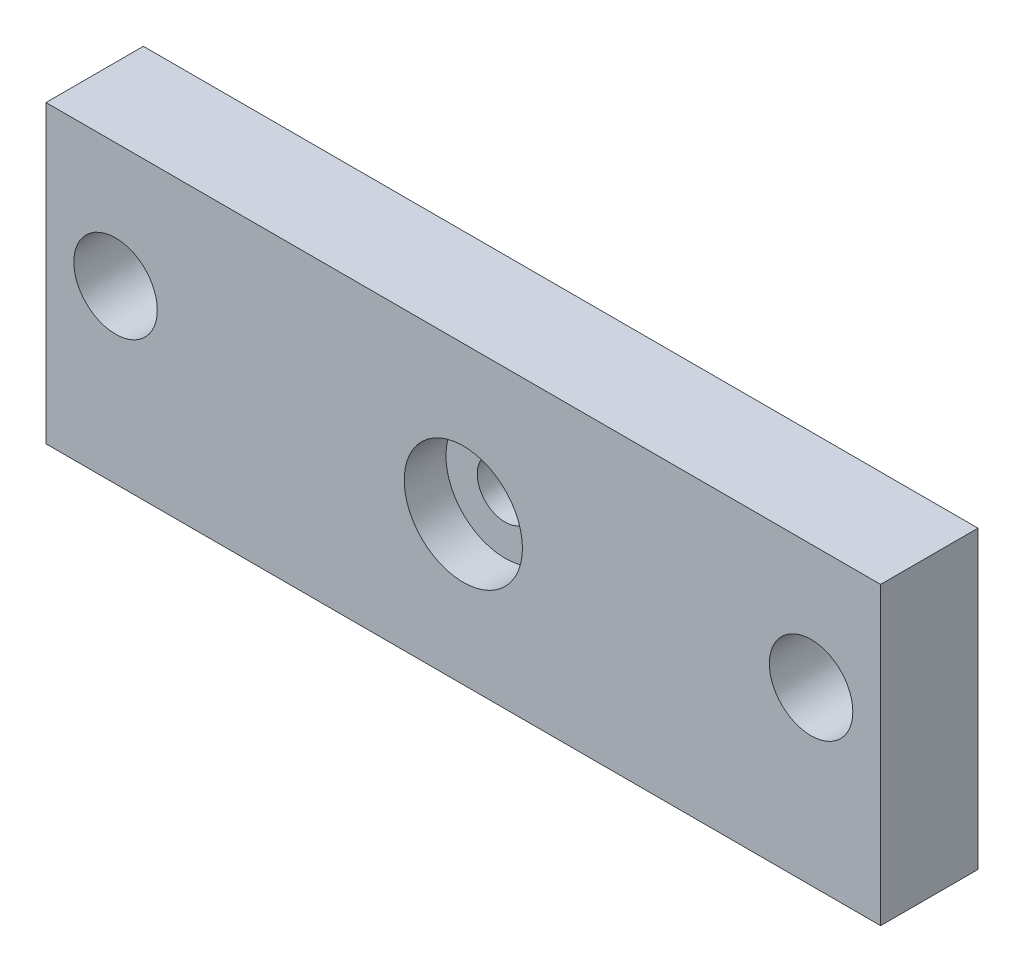
from build123d import *

# Parameters (mm, degrees)
SKETCH1_W           = 120
SKETCH1_H           = 42.5
BOSS_EXTRUDE1_DEPTH = 7
SKETCH2_R           = 8.5
CUT_EXTRUDE1_DEPTH  = 6
SKETCH3_R           = 4
CUT_EXTRUDE2_DEPTH  = 65.152649984
SKETCH5_R           = 6
CUT_EXTRUDE4_DEPTH  = 66.173326599
SKETCH6_R           = 2.5
SKETCH6_R_2         = 1.25
CUT_EXTRUDE5_DEPTH  = 10


with BuildPart() as part:
    # Sketch1 → Boss-Extrude1 (new, symmetric)
    with BuildSketch(Plane.XY):
        Rectangle(SKETCH1_W, SKETCH1_H)
    extrude(amount=BOSS_EXTRUDE1_DEPTH, both=True)

    # Sketch2 → Cut-Extrude1 (cut)
    with BuildSketch(Plane.XY.offset(7)):
        Circle(SKETCH2_R)
    extrude(amount=-CUT_EXTRUDE1_DEPTH, mode=Mode.SUBTRACT)

    # Sketch3 → Cut-Extrude2 (cut, through all)
    with BuildSketch(Plane.XY.offset(1)):
        Circle(SKETCH3_R)
    extrude(amount=-CUT_EXTRUDE2_DEPTH, mode=Mode.SUBTRACT)

    # Sketch5 → Cut-Extrude4 (cut, through all)
    with BuildSketch(Plane.XY.offset(7)):
        with Locations((-50, 3.4)):
            Circle(SKETCH5_R)
        with Locations((50, 3.4)):
            Circle(SKETCH5_R)
    extrude(amount=-CUT_EXTRUDE4_DEPTH, mode=Mode.SUBTRACT)

    # Sketch6 → Cut-Extrude5 (cut)
    with BuildSketch(Plane.XZ.offset(21.25)):
        with Locations((-50, 0)):
            Circle(SKETCH6_R)
        with Locations((-25, 0)):
            Circle(SKETCH6_R)
        with Locations((25, 0)):
            Circle(SKETCH6_R)
        with Locations((50, 0)):
            Circle(SKETCH6_R)
        with Locations((-37.5, 0)):
            Circle(SKETCH6_R_2)
        with Locations((37.5, 0)):
            Circle(SKETCH6_R_2)
    extrude(amount=-CUT_EXTRUDE5_DEPTH, mode=Mode.SUBTRACT)


solid = part.part
